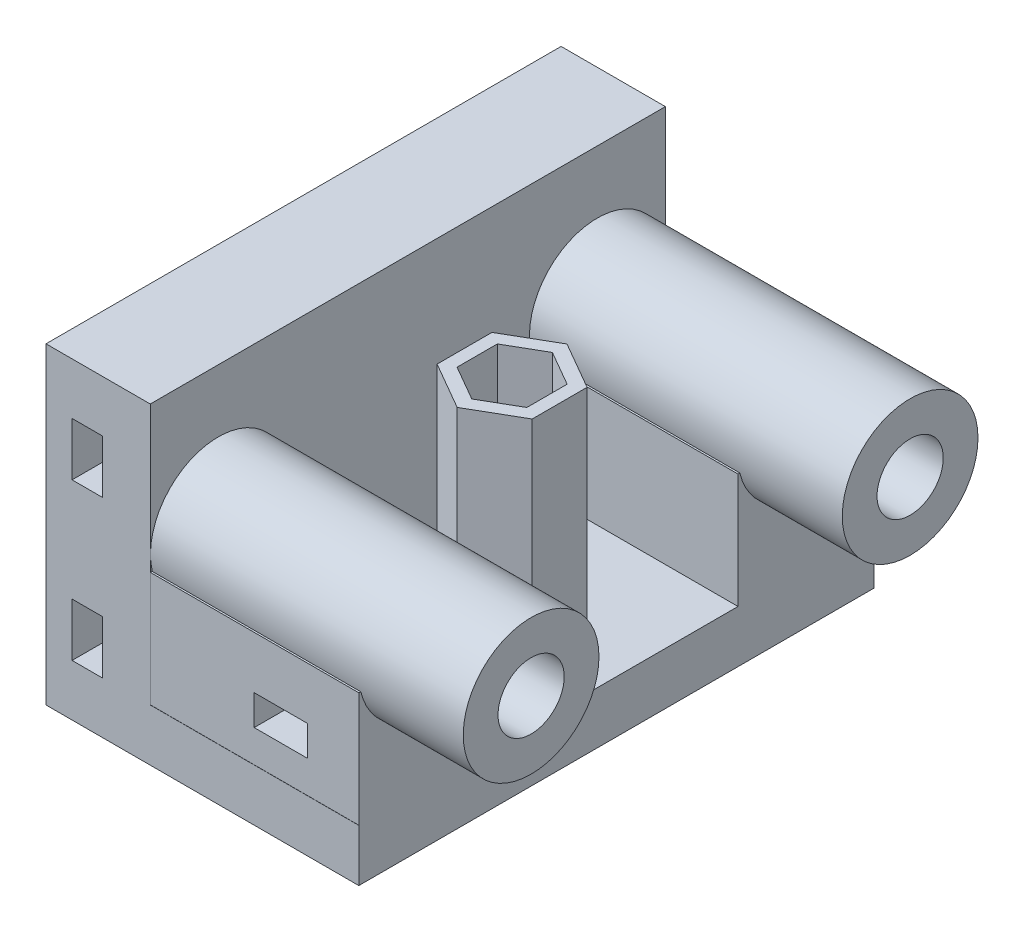
from build123d import *

# Parameters (mm, degrees)
SKETCH1_W           = 88.9
SKETCH1_H           = 76.2
BOSS_EXTRUDE1_DEPTH = 25.4
SKETCH2_R           = 4.1021
CUT_EXTRUDE1_DEPTH  = 19.05
SKETCH3_W           = 7.366
SKETCH3_H           = 12.954
CUT_EXTRUDE2_DEPTH  = 12.954
SKETCH5_W           = 88.9
SKETCH5_H           = 12.7
BOSS_EXTRUDE2_DEPTH = 50.8
SKETCH6_R           = 16.53116582
SKETCH6_R_2         = 8.0645
BOSS_EXTRUDE3_DEPTH = 76.2
SKETCH7_W           = 7.366
SKETCH7_H           = 12.954
BOSS_EXTRUDE4_DEPTH = 18.288
SKETCH8_W           = 50.8
SKETCH8_H           = 33.06233164
BOSS_EXTRUDE5_DEPTH = 27.94
CUT_EXTRUDE5_START  = -76.2
SKETCH11_R          = 8.0645
CUT_EXTRUDE5_DEPTH  = 76.2
CUT_EXTRUDE6_REACH  = 168.187
SKETCH12_R          = 4.1021
SKETCH13_W          = 12.954
SKETCH13_H          = 7.366
CUT_EXTRUDE7_DEPTH  = 22.9616
BOSS_EXTRUDE6_DEPTH = 50.8
CUT_EXTRUDE8_REACH  = 162.761
SKETCH14_3_R        = 5.25
CUT_EXTRUDE9_DEPTH  = 9


with BuildPart() as part:
    # Sketch1 → Boss-Extrude1 (new body)
    with BuildSketch(Plane(origin=(0, 0, 0), x_dir=(0, 0, -1), z_dir=(1, 0, 0))):
        with Locations((44.45, 38.1)):
            Rectangle(SKETCH1_W, SKETCH1_H)
    extrude(amount=BOSS_EXTRUDE1_DEPTH)

    # Sketch2 → Cut-Extrude1 (cut)
    with BuildSketch(Plane.ZY):
        with Locations((-82.55, 57.15)):
            Circle(SKETCH2_R)
        with Locations((-82.55, 19.05)):
            Circle(SKETCH2_R)
        with Locations((-6.35, 19.05)):
            Circle(SKETCH2_R)
        with Locations((-6.35, 57.15)):
            Circle(SKETCH2_R)
    extrude(amount=-CUT_EXTRUDE1_DEPTH, mode=Mode.SUBTRACT)

    # Sketch3 → Cut-Extrude2 (cut)
    with BuildSketch(Plane.XY):
        with Locations((10.033, 57.15)):
            Rectangle(SKETCH3_W, SKETCH3_H)
        with Locations((10.033, 19.05)):
            Rectangle(SKETCH3_W, SKETCH3_H)
    cut_extrude2 = extrude(amount=-CUT_EXTRUDE2_DEPTH, mode=Mode.SUBTRACT)

    # Mirror1: Cut-Extrude2 across plane
    add(cut_extrude2.mirror(Plane.XY.offset(-44.45)), mode=Mode.SUBTRACT)

    # Sketch5 → Boss-Extrude2 (add)
    with BuildSketch(Plane(origin=(25.4, 0, 0), x_dir=(0, 0, -1), z_dir=(1, 0, 0))):
        with Locations((44.45, 6.35)):
            Rectangle(SKETCH5_W, SKETCH5_H)
    extrude(amount=BOSS_EXTRUDE2_DEPTH)

    # Sketch6 → Boss-Extrude3 (add)
    # profile 1 of 2: a face of its own
    with BuildSketch(Plane(origin=(25.4, 0, 0), x_dir=(0, 0, -1), z_dir=(1, 0, 0))):
        with Locations((-1.7145, 44.45)):
            Circle(SKETCH6_R)
        with Locations((-1.7145, 44.45)):
            Circle(SKETCH6_R_2, mode=Mode.SUBTRACT)
    # profile 2 of 2: a face of its own
    with BuildSketch(Plane(origin=(25.4, 0, 0), x_dir=(0, 0, -1), z_dir=(1, 0, 0))):
        with Locations((90.6145, 44.45)):
            Circle(SKETCH6_R)
        with Locations((90.6145, 44.45)):
            Circle(SKETCH6_R_2, mode=Mode.SUBTRACT)
    extrude(amount=BOSS_EXTRUDE3_DEPTH)

    # Sketch7 → Boss-Extrude4 (add)
    with BuildSketch(Plane.XY):
        Polygon((76.2, 12.7), (25.4, 12.7), (25.4, 76.2), (0, 76.2), (0, 0), (76.2, 0), align=None)
        with Locations((10.033, 57.15)):
            Rectangle(SKETCH7_W, SKETCH7_H, mode=Mode.SUBTRACT)
        with Locations((10.033, 19.05)):
            Rectangle(SKETCH7_W, SKETCH7_H, mode=Mode.SUBTRACT)
    boss_extrude4 = extrude(amount=BOSS_EXTRUDE4_DEPTH)

    # Mirror2: Boss-Extrude4 across plane
    add(boss_extrude4.mirror(Plane.XY.offset(-44.45)))

    # Sketch8 → Boss-Extrude5 (add)
    with BuildSketch(Plane(origin=(0, 12.7, 0), x_dir=(1, 0, 0), z_dir=(0, 1, 0))):
        with Locations((50.8, -1.7145)):
            Rectangle(SKETCH8_W, SKETCH8_H)
    boss_extrude5 = extrude(amount=BOSS_EXTRUDE5_DEPTH)

    # Sketch11 → Cut-Extrude5 (cut)
    with BuildSketch(Plane(origin=(101.6, 0, 0), x_dir=(0, 0, -1), z_dir=(1, 0, 0)).offset(CUT_EXTRUDE5_START)):
        with Locations((-1.7145, 44.45)):
            Circle(SKETCH11_R)
    cut_extrude5 = extrude(amount=CUT_EXTRUDE5_DEPTH, mode=Mode.SUBTRACT)

    # Sketch12 → Cut-Extrude6 (cut, up to next)
    with BuildSketch(Plane.XZ, mode=Mode.PRIVATE) as cut_extrude6_sk1:
        with Locations((57.15, 1.7145)):
            Circle(SKETCH12_R)
    cut_extrude6_tool1 = extrude(cut_extrude6_sk1.sketch, amount=-CUT_EXTRUDE6_REACH, mode=Mode.PRIVATE) & part.part
    cut_extrude6 = cut_extrude6_tool1.solids().sort_by_distance((57.15, 0, 1.7145))[0]
    add(cut_extrude6, mode=Mode.SUBTRACT)

    # Sketch13 → Cut-Extrude7 (cut)
    with BuildSketch(Plane.XY.offset(18.24566582)):
        with Locations((57.15, 24.23583418)):
            Rectangle(SKETCH13_W, SKETCH13_H)
    cut_extrude7 = extrude(amount=-CUT_EXTRUDE7_DEPTH, mode=Mode.SUBTRACT)

    # Mirror3: Boss-Extrude5, Cut-Extrude5, Cut-Extrude6, Cut-Extrude7 across plane
    add(boss_extrude5.mirror(Plane.XY.offset(-44.45)))
    add(cut_extrude5.mirror(Plane.XY.offset(-44.45)), mode=Mode.SUBTRACT)
    add(cut_extrude6.mirror(Plane.XY.offset(-44.45)), mode=Mode.SUBTRACT)
    add(cut_extrude7.mirror(Plane.XY.offset(-44.45)), mode=Mode.SUBTRACT)

    # Sketch14 → Boss-Extrude6 (add)
    with BuildSketch(Plane(origin=(0, 12.7, 0), x_dir=(1, 0, 0), z_dir=(0, 1, 0))):
        Polygon((62.381615184, 51.136648644), (50.8, 57.823297288), (39.218384816, 51.136648644), (39.218384816, 37.763351356), (50.8, 31.076702712), (62.381615184, 37.763351356), align=None)
        Polygon((50.8, 34.635045424), (42.3, 39.542522712), (42.3, 49.357477288), (50.8, 54.264954576), (59.3, 49.357477288), (59.3, 39.542522712), align=None, mode=Mode.SUBTRACT)
    extrude(amount=BOSS_EXTRUDE6_DEPTH)

    # Sketch14<3> → Cut-Extrude8 (cut, up to next)
    with BuildSketch(Plane(origin=(0, 12.7, 0), x_dir=(1, 0, 0), z_dir=(0, 1, 0)), mode=Mode.PRIVATE) as cut_extrude8_sk1:
        with Locations((50.8, 44.45)):
            Circle(SKETCH14_3_R)
    cut_extrude8_tool1 = extrude(cut_extrude8_sk1.sketch, amount=-CUT_EXTRUDE8_REACH, mode=Mode.PRIVATE) & part.part
    add(cut_extrude8_tool1.solids().sort_by_distance((50.8, 12.7, -44.45))[0], mode=Mode.SUBTRACT)

    # Sketch15 → Cut-Extrude9 (cut)
    with BuildSketch(Plane.XZ):
        Polygon((59.35, -39.513655198), (50.8, -34.577310397), (42.25, -39.513655198), (42.25, -49.386344802), (50.8, -54.322689603), (59.35, -49.386344802), align=None)
    extrude(amount=-CUT_EXTRUDE9_DEPTH, mode=Mode.SUBTRACT)


solid = part.part
